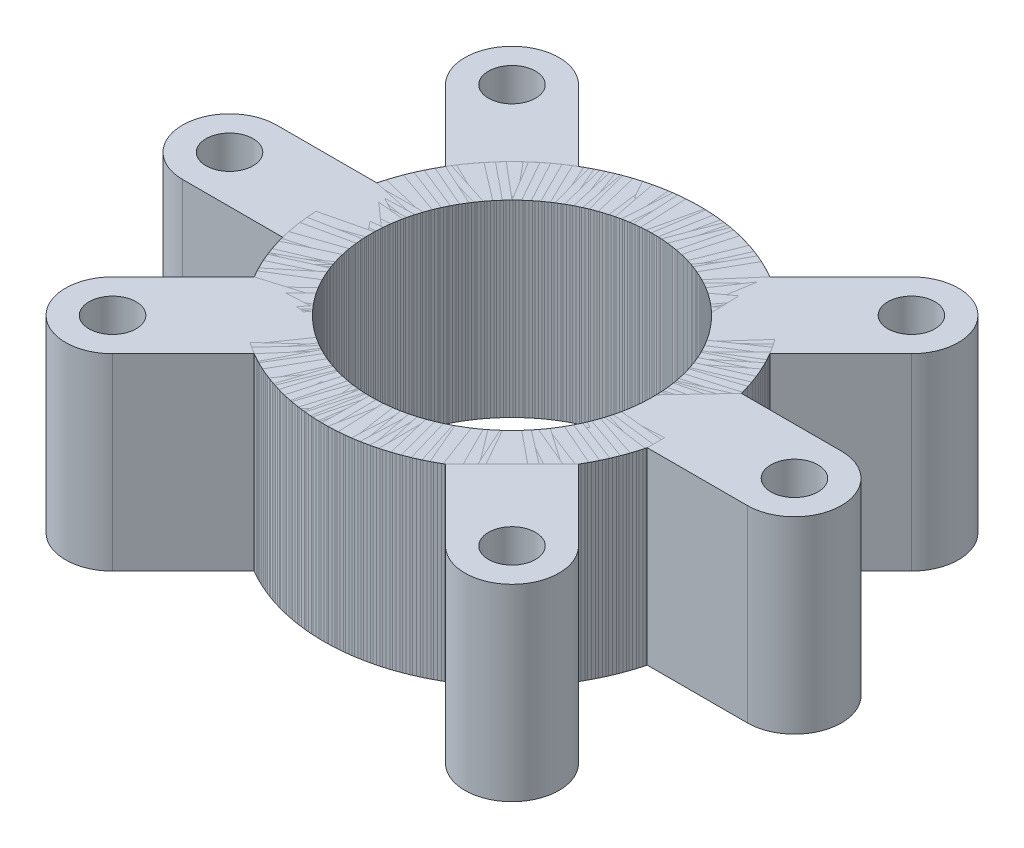
from build123d import *

# Parameters (mm, degrees)
SKETCH1_R                  = 40
SKETCH1_R_2                = 30
BOSS_EXTRUDE1_DEPTH        = 40
SKETCH2_R                  = 10
SKETCH2_R_2                = 5
BOSS_EXTRUDE2_DEPTH        = 40
BOSS_EXTRUDE3_DEPTH        = 40
BOSS_EXTRUDE10_DEPTH       = 40
CIRPATTERN13_OUTLINE_R     = 5
CIRPATTERN13_OUTLINE_R_2   = 30
CIRPATTERN13_DEPTH         = 40
CIRPATTERN13_2_OUTLINE_R   = 5
CIRPATTERN13_2_OUTLINE_R_2 = 30
CIRPATTERN13_2_DEPTH       = 40
CIRPATTERN13_3_OUTLINE_R   = 30
CIRPATTERN13_3_OUTLINE_R_2 = 5
CIRPATTERN13_3_DEPTH       = 40
CIRPATTERN13_4_OUTLINE_R   = 30
CIRPATTERN13_4_OUTLINE_R_2 = 5
CIRPATTERN13_4_DEPTH       = 40
CIRPATTERN13_5_OUTLINE_R   = 30
CIRPATTERN13_5_OUTLINE_R_2 = 5
CIRPATTERN13_5_DEPTH       = 40


# Read off the part's stored shape, not the designer's step: CirPattern13
with BuildPart() as part:
    # Sketch1 → Boss-Extrude1 (new body)
    with BuildSketch(Plane(origin=(0, 0, 0), x_dir=(1, 0, 0), z_dir=(0, 1, 0))):
        with Locations(Location((0, 0, 0), (0, 0, 270))):
            Circle(SKETCH1_R)
        with Locations(Location((0, 0, 0), (0, 0, 270))):
            Circle(SKETCH1_R_2, mode=Mode.SUBTRACT)
    extrude(amount=BOSS_EXTRUDE1_DEPTH)



with BuildPart() as body_2:
    # Sketch2 → Boss-Extrude2 (new body)
    with BuildSketch(Plane(origin=(0, 40, 0), x_dir=(1, 0, 0), z_dir=(0, 1, 0))):
        with Locations(Location((-60, 0, 0), (0, 0, 270))):
            Circle(SKETCH2_R)
        with Locations(Location((-60, 0, 0), (0, 0, 270))):
            Circle(SKETCH2_R_2, mode=Mode.SUBTRACT)
    extrude(amount=-BOSS_EXTRUDE2_DEPTH)


with BuildPart() as part_1:
    add(part.part)

    add(body_2.part)  # Boss-Extrude3 merges body 2
    # Sketch3 → Boss-Extrude3 (add)
    with BuildSketch(Plane(origin=(0, 40, 0), x_dir=(1, 0, 0), z_dir=(0, 1, 0))):
        Polygon((-60, 10), (-38.729833462, 10), (-38.729833462, -10), align=None)
    extrude(amount=-BOSS_EXTRUDE3_DEPTH)

    # Sketch4 → Boss-Extrude10 (add)
    with BuildSketch(Plane(origin=(0, 40, 0), x_dir=(1, 0, 0), z_dir=(0, 1, 0))):
        Polygon((-60, -10), (-38.729833462, -10), (-48.078623612, 10), align=None)
    extrude(amount=-BOSS_EXTRUDE10_DEPTH)


with BuildPart() as body_2_2:
    # CirPattern13 outline → CirPattern13 (new body)
    with BuildSketch(Plane(origin=(0, 0, 0), x_dir=(1, 0, 0), z_dir=(0, 1, 0))):
        with BuildLine():
            ThreePointArc((-20.315060063, -34.457195687), (28.284271247, 28.284271247), (-34.457195687, -20.315060063))
            Line((-34.457195687, -20.315060063), (-49.497474683, -35.355339059))
            ThreePointArc((-49.497474683, -35.355339059), (-49.497474683, -49.497474683), (-35.355339059, -49.497474683))
            Line((-35.355339059, -49.497474683), (-20.315060063, -34.457195687))
        make_face()
        with Locations((-42.426406871, -42.426406871)):
            Circle(CIRPATTERN13_OUTLINE_R, mode=Mode.SUBTRACT)
        Circle(CIRPATTERN13_OUTLINE_R_2, mode=Mode.SUBTRACT)
    extrude(amount=CIRPATTERN13_DEPTH)


with BuildPart() as body_3:
    # CirPattern13 2 outline → CirPattern13 2 (new body)
    with BuildSketch(Plane(origin=(0, 0, 0), x_dir=(1, 0, 0), z_dir=(0, 1, 0))):
        with BuildLine():
            ThreePointArc((34.457195687, -20.315060063), (-28.284271247, 28.284271247), (20.315060063, -34.457195687))
            Line((20.315060063, -34.457195687), (35.355339059, -49.497474683))
            ThreePointArc((35.355339059, -49.497474683), (49.497474683, -49.497474683), (49.497474683, -35.355339059))
            Line((49.497474683, -35.355339059), (34.457195687, -20.315060063))
        make_face()
        with Locations((42.426406871, -42.426406871)):
            Circle(CIRPATTERN13_2_OUTLINE_R, mode=Mode.SUBTRACT)
        Circle(CIRPATTERN13_2_OUTLINE_R_2, mode=Mode.SUBTRACT)
    extrude(amount=CIRPATTERN13_2_DEPTH)


with BuildPart() as body_4:
    # CirPattern13 3 outline → CirPattern13 3 (new body)
    with BuildSketch(Plane(origin=(0, 0, 0), x_dir=(1, 0, 0), z_dir=(0, 1, 0))):
        with BuildLine():
            ThreePointArc((38.729833462, 10), (-40, 0), (38.729833462, -10))
            Line((38.729833462, -10), (60, -10))
            ThreePointArc((60, -10), (70, 0), (60, 10))
            Line((60, 10), (38.729833462, 10))
        make_face()
        Circle(CIRPATTERN13_3_OUTLINE_R, mode=Mode.SUBTRACT)
        with Locations((60, 0)):
            Circle(CIRPATTERN13_3_OUTLINE_R_2, mode=Mode.SUBTRACT)
    extrude(amount=CIRPATTERN13_3_DEPTH)


with BuildPart() as body_5:
    # CirPattern13 4 outline → CirPattern13 4 (new body)
    with BuildSketch(Plane(origin=(0, 0, 0), x_dir=(1, 0, 0), z_dir=(0, 1, 0))):
        with BuildLine():
            ThreePointArc((20.315060063, 34.457195687), (-28.284271247, -28.284271247), (34.457195687, 20.315060063))
            Line((34.457195687, 20.315060063), (49.497474683, 35.355339059))
            ThreePointArc((49.497474683, 35.355339059), (49.497474683, 49.497474683), (35.355339059, 49.497474683))
            Line((35.355339059, 49.497474683), (20.315060063, 34.457195687))
        make_face()
        Circle(CIRPATTERN13_4_OUTLINE_R, mode=Mode.SUBTRACT)
        with Locations((42.426406871, 42.426406871)):
            Circle(CIRPATTERN13_4_OUTLINE_R_2, mode=Mode.SUBTRACT)
    extrude(amount=CIRPATTERN13_4_DEPTH)


with BuildPart() as body_6:
    # CirPattern13 5 outline → CirPattern13 5 (new body)
    with BuildSketch(Plane(origin=(0, 0, 0), x_dir=(1, 0, 0), z_dir=(0, 1, 0))):
        with BuildLine():
            ThreePointArc((-34.457195687, 20.315060063), (28.284271247, -28.284271247), (-20.315060063, 34.457195687))
            Line((-20.315060063, 34.457195687), (-35.355339059, 49.497474683))
            ThreePointArc((-35.355339059, 49.497474683), (-49.497474683, 49.497474683), (-49.497474683, 35.355339059))
            Line((-49.497474683, 35.355339059), (-34.457195687, 20.315060063))
        make_face()
        Circle(CIRPATTERN13_5_OUTLINE_R, mode=Mode.SUBTRACT)
        with Locations((-42.426406871, 42.426406871)):
            Circle(CIRPATTERN13_5_OUTLINE_R_2, mode=Mode.SUBTRACT)
    extrude(amount=CIRPATTERN13_5_DEPTH)


solid = Compound([part_1.part, body_2_2.part, body_3.part, body_4.part, body_5.part, body_6.part])
